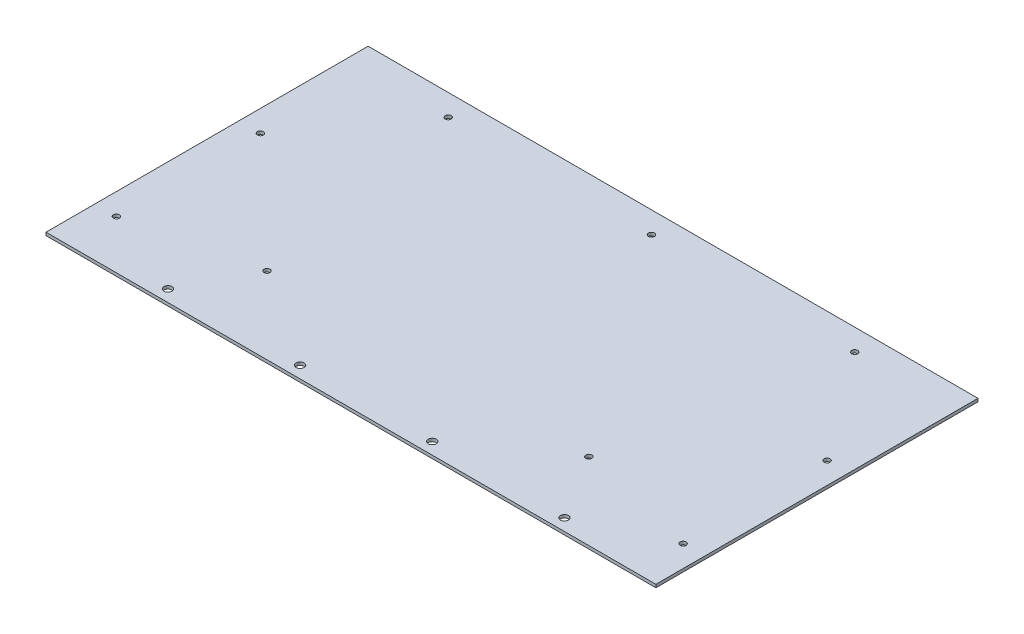
from build123d import *

# Parameters (mm, degrees)
SKETCH1_W            = 457.2
SKETCH1_H            = 2.286
BOSS_EXTRUDE1_DEPTH  = 238.315200026
SKETCH2_W            = 457.2
SKETCH2_H            = 2.286
BOSS_EXTRUDE2_DEPTH  = 3.175
SKETCH9_R            = 3
CUT_EXTRUDE10_DEPTH  = 2.54
LPATTERN1_COUNT      = 4
LPATTERN1_PITCH      = 99.06
M4_CLEARANCE_HOLE1_D = 4.5


with BuildPart() as part:
    # Sketch1 → Boss-Extrude1 (new body)
    with BuildSketch(Plane.XY):
        Rectangle(SKETCH1_W, SKETCH1_H)
    extrude(amount=BOSS_EXTRUDE1_DEPTH)

    # Sketch2 → Boss-Extrude2 (add)
    with BuildSketch(Plane(origin=(0, 0, 0), x_dir=(-1, 0, 0), z_dir=(0, 0, -1))):
        Rectangle(SKETCH2_W, SKETCH2_H)
    extrude(amount=BOSS_EXTRUDE2_DEPTH)

    # Sketch9 → Cut-Extrude10 (cut)
    with BuildSketch(Plane(origin=(0, 1.143, 0), x_dir=(1, 0, 0), z_dir=(0, 1, 0))):
        with Locations((-146.05, -229.425200026)):
            Circle(SKETCH9_R)
    cut_extrude10 = extrude(amount=-CUT_EXTRUDE10_DEPTH, mode=Mode.SUBTRACT)

    # LPattern1: Cut-Extrude10 ×4
    with Locations(*[(i * LPATTERN1_PITCH, 0, 0) for i in range(1, LPATTERN1_COUNT)]):
        add(cut_extrude10, mode=Mode.SUBTRACT)

    # M4 Clearance Hole1 (through all)
    with Locations(Plane.XZ.offset(1.143)):
        with Locations((-212.419, 93.774823778), (-152.4, 13.0175), (0, 13.0175), (152.4, 13.0175), (212.419, 93.774823778), (212.419, 201.724823778), (120.65, 180.586), (-120.65, 180.586), (-212.419, 201.724823778)):
            Hole(M4_CLEARANCE_HOLE1_D / 2)


solid = part.part
